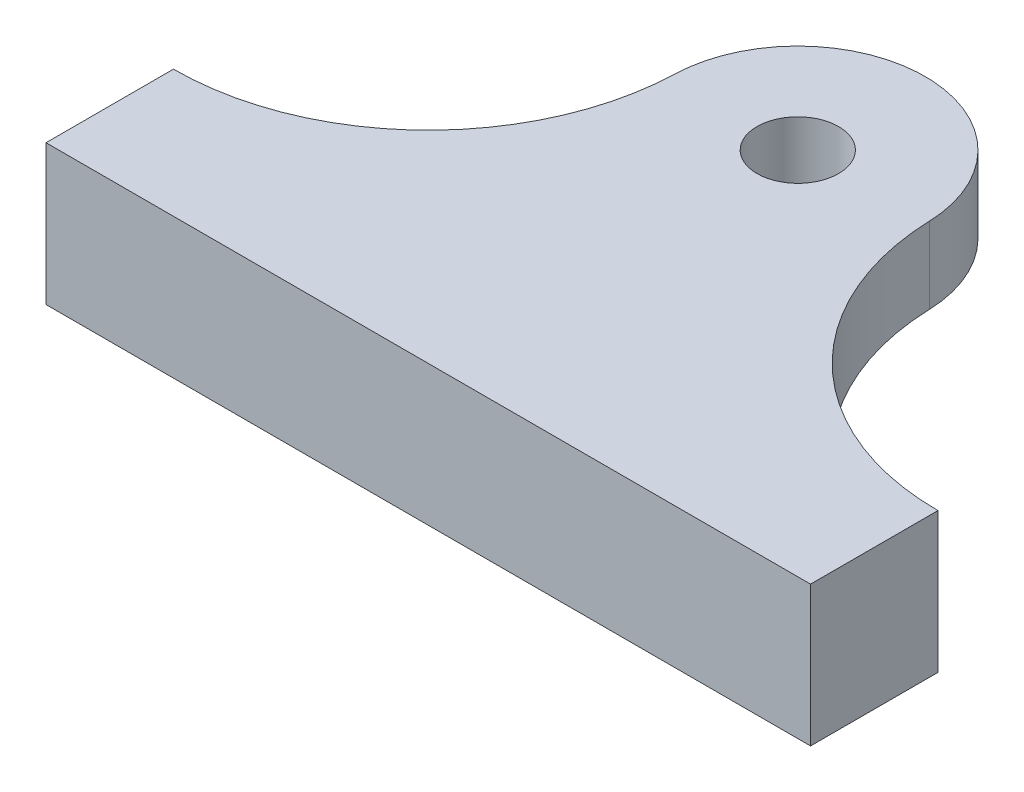
from build123d import *

# Parameters (mm, degrees)
SKETCH_1_R      = 1.6
EXTRUDE_1_DEPTH = 3
SKETCH_2_W      = 30
SKETCH_2_H      = 5
EXTRUDE_2_DEPTH = 5.5
FILLET_1_R      = 10


with BuildPart() as part:
    # 草图1 → 凸台-拉伸1 (new body)
    with BuildSketch(Plane(origin=(0, 0, 0), x_dir=(1, 0, 0), z_dir=(0, 1, 0))):
        with BuildLine():
            Line((-5, 0), (-5, -9.5))
            Line((-5, -9.5), (5, -9.5))
            Line((5, -9.5), (5, 0))
            ThreePointArc((5, 0), (0, 5), (-5, 0))
        make_face()
        with Locations(Location((0, 0, 0), (0, 0, 270))):
            Circle(SKETCH_1_R, mode=Mode.SUBTRACT)
    extrude(amount=EXTRUDE_1_DEPTH)

    # 草图2 → 凸台-拉伸2 (add)
    with BuildSketch(Plane(origin=(0, 3, 0), x_dir=(1, 0, 0), z_dir=(0, 1, 0))):
        with Locations((0, -12)):
            Rectangle(SKETCH_2_W, SKETCH_2_H)
    extrude(amount=-EXTRUDE_2_DEPTH)

    # 圆角1
    # the kernel refuses this fillet: 10 mm, written as the material it adds along each edge
    with BuildSketch(Plane(origin=(-5, 0, 9.5), x_dir=(-1, 0, 0), z_dir=(0, 1, 0))) as fillet_1_piece_1:
        with BuildLine():
            CenterArc((9.991664351, -10), FILLET_1_R, 90, 88.089786828)
            Line((-0.00277855, -9.666666667), (-1.00222284, -9.633333333))
            ThreePointArc((-1.00222284, -9.633333333), (-1, -9.5), (-1, 0))
            Line((-1, 0), (0, 1))
            Line((0, 1), (9.991664351, 1))
            Line((9.991664351, 1), (9.991664351, 0))
        make_face()
    extrude(amount=3)
    with BuildSketch(Plane(origin=(5, 0, 9.5), x_dir=(1, 0, 0), z_dir=(0, 1, 0))) as fillet_1_piece_2:
        with BuildLine():
            CenterArc((9.991664351, 10), FILLET_1_R, 181.910213172, 88.089786828)
            Line((-0.00277855, 9.666666667), (-1.00222284, 9.633333333))
            ThreePointArc((-1.00222284, 9.633333333), (-1, 9.5), (-1, 0))
            Line((-1, 0), (0, -1))
            Line((0, -1), (9.991664351, -1))
            Line((9.991664351, -1), (9.991664351, 0))
        make_face()
    extrude(amount=3)


solid = part.part
